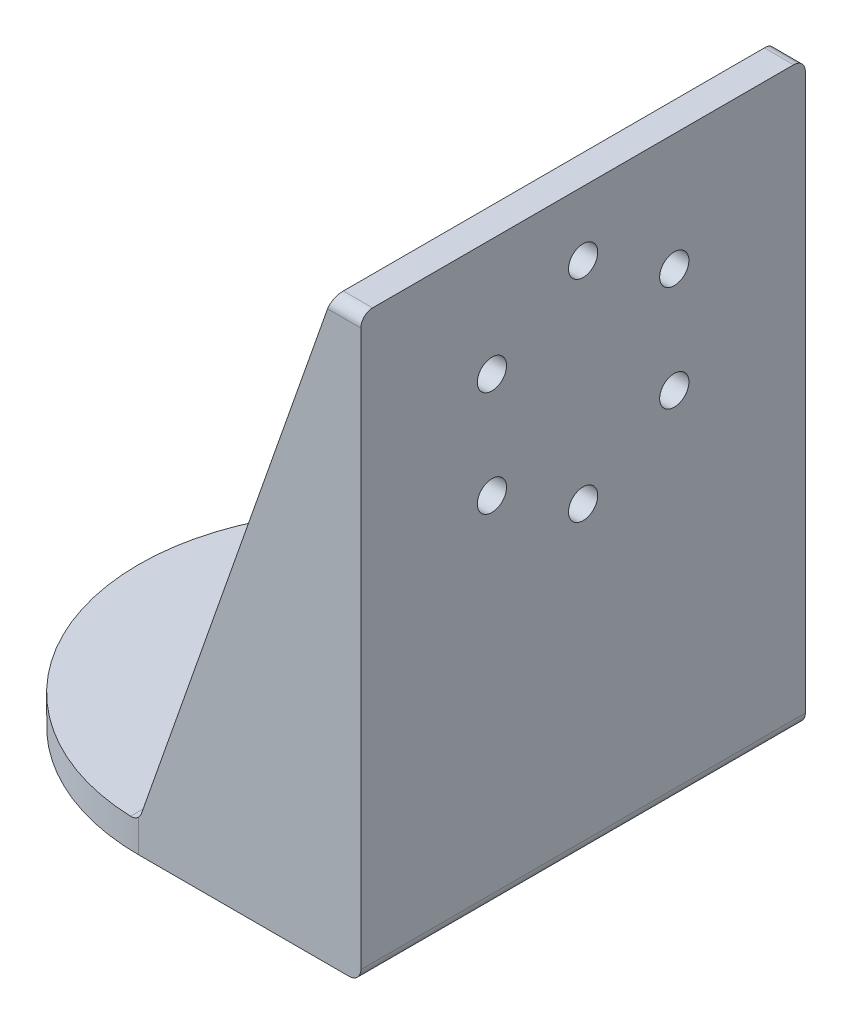
from build123d import *

# Parameters (mm, degrees)
EXTRUDE_1_DEPTH     = 76
FILLET_1_R          = 38
RIB_1_REACH         = 148.127
SKETCH_4_WALL_W     = 393.877609006
SKETCH_4_WALL_H     = 5
RIB_START           = -5
RIB_2_DEPTH         = 5
SKETCH_7_R          = 2.5
CUT_EXTRUDE_1_DEPTH = 10
SKETCH_8_R          = 2.5
CUT_EXTRUDE_2_DEPTH = 10
FILLET_2_R          = 2
CHAMFER_1_SIZE      = 10
CHAMFER_1_SIZE2     = 5
FILLET_3_R          = 2
FILLET_4_R          = 2


# Read off the part's stored shape, not the designer's step: Ребро2
with BuildPart() as part:
    # Эскиз3 → Бобышка-Вытянуть1 (new body)
    with BuildSketch(Plane.XY):
        Polygon((76, 0), (0, 0), (0, 5), (71, 5), (71, 99), (76, 99), align=None)
    extrude(amount=EXTRUDE_1_DEPTH)

    # Скругление1
    fillet_1_edges = [part.edges().sort_by_distance(p)[0] for p in [
        (0, 2.5, 0),
        (0, 2.5, 76),
    ]]
    fillet(fillet_1_edges, radius=FILLET_1_R - 0.0001)  # a hair under: the kernel refuses the full size

    # Эскиз4 wall → Ребро1 (add, up to next)
    with BuildSketch(Plane(origin=(54.5, 52, 76), x_dir=(-0.331244504731, -0.94354495287, 0), z_dir=(0.94354495287, -0.331244504731, 0)), mode=Mode.PRIVATE) as rib_1_sk1:
        with Locations((0, 2.5)):
            Rectangle(SKETCH_4_WALL_W, SKETCH_4_WALL_H)
    rib_1_tool1 = extrude(rib_1_sk1.sketch, amount=RIB_1_REACH, mode=Mode.PRIVATE) - part.part
    add(rib_1_tool1.solids().sort_by_distance((54.5, 52, 76))[0])

    # Ребро2 outline → Ребро2 (add)
    with BuildSketch(Plane(origin=(0, 0, 0), x_dir=(-1, 0, 0), z_dir=(0, 0, -1)).offset(RIB_START)):
        Polygon((-38, 5), (-71, 99), (-71, 5), align=None)
    extrude(amount=RIB_2_DEPTH)

    # Эскиз7 → Вырез-Вытянуть1 (cut)
    with BuildSketch(Plane(origin=(0, 5, 0), x_dir=(1, 0, 0), z_dir=(0, 1, 0))):
        with Locations(Location((20, -38, 0), (0, 0, 180))):
            Circle(SKETCH_7_R)
        with Locations(Location((29, -22.411542732, 0), (0, 0, 180))):
            Circle(SKETCH_7_R)
        with Locations(Location((47, -22.411542732, 0), (0, 0, 180))):
            Circle(SKETCH_7_R)
        with Locations(Location((56, -38, 0), (0, 0, 180))):
            Circle(SKETCH_7_R)
        with Locations(Location((47, -53.588457268, 0), (0, 0, 180))):
            Circle(SKETCH_7_R)
        with Locations(Location((29, -53.588457268, 0), (0, 0, 180))):
            Circle(SKETCH_7_R)
    extrude(amount=-CUT_EXTRUDE_1_DEPTH, mode=Mode.SUBTRACT)

    # Эскиз8 → Вырез-Вытянуть2 (cut)
    with BuildSketch(Plane(origin=(76, 0, 0), x_dir=(0, 0, -1), z_dir=(1, 0, 0))):
        with Locations((-38, 52)):
            Circle(SKETCH_8_R)
        with Locations((-53.588457268, 61)):
            Circle(SKETCH_8_R)
        with Locations((-53.588457268, 79)):
            Circle(SKETCH_8_R)
        with Locations((-38, 88)):
            Circle(SKETCH_8_R)
        with Locations((-22.411542732, 79)):
            Circle(SKETCH_8_R)
        with Locations((-22.411542732, 61)):
            Circle(SKETCH_8_R)
    extrude(amount=-CUT_EXTRUDE_2_DEPTH, mode=Mode.SUBTRACT)

    # Скругление2
    fillet_2_edges = [part.edges().sort_by_distance(p)[0] for p in [
        (76, 0, 38),
    ]]
    fillet(fillet_2_edges, radius=FILLET_2_R)

    # Фаска1
    chamfer_1_edges = [part.edges().sort_by_distance(p)[0] for p in [
        (71, 5, 38),
    ]]
    chamfer_1_side = [part.faces().sort_by_distance(p)[0] for p in [
        (71, 52, 6.148564321),
    ]]
    chamfer(chamfer_1_edges, length=CHAMFER_1_SIZE, length2=CHAMFER_1_SIZE2, reference=chamfer_1_side[0])

    # Скругление3
    fillet_3_edges = [part.edges().sort_by_distance(p)[0] for p in [
        (38, 5, 73.5),
        (38, 5, 2.5),
    ]]
    fillet(fillet_3_edges, radius=FILLET_3_R)

    # Скругление4
    fillet_4_edges = [part.edges().sort_by_distance(p)[0] for p in [
        (73.5, 99, 76),
        (73.5, 99, 0),
    ]]
    fillet(fillet_4_edges, radius=FILLET_4_R)


solid = part.part
